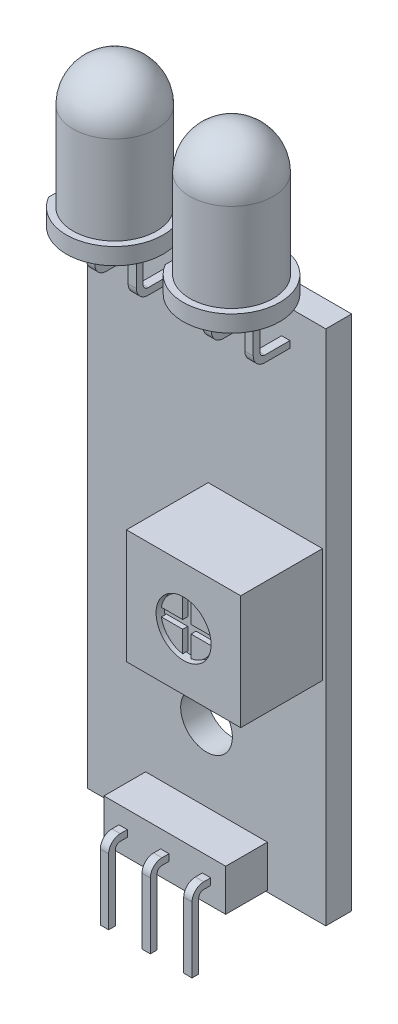
from build123d import *

# Parameters (mm, degrees)
ESBO_O1_W                   = 14.3
ESBO_O1_H                   = 31
ESBO_O1_R                   = 1.55
RESSALTO_EXTRUS_O1_DEPTH    = 1.55
ESBO_O2_W                   = 6.85
ESBO_O2_H                   = 6.85
RESSALTO_EXTRUS_O2_DEPTH    = 6.45
ESBO_O3_R                   = 1.65
CORTE_EXTRUS_O1_DEPTH       = 0.5
ESBO_O4_W                   = 7.3
ESBO_O4_H                   = 2.5
RESSALTO_EXTRUS_O3_DEPTH    = 4.05
RESSALTO_EXTRUS_O4_DEPTH    = 1
RESSALTO_EXTRUS_O4_2_DEPTH  = 1
ESBO_O6_R                   = 2.5
RESSALTO_EXTRUS_O5_DEPTH    = 8.8
FILETE1_R                   = 2.5
FILETE2_R                   = 2.5
RESSALTO_EXTRUS_O6_DEPTH    = 13.8
ESBO_O9_R                   = 1.55
CORTE_EXTRUS_O3_DEPTH       = 0.2
CORTE_EXTRUS_O2_START       = -2.2
CORTE_EXTRUS_O2_OUTLINE_W   = 1.65
CORTE_EXTRUS_O2_OUTLINE_H   = 3.08301819
CORTE_EXTRUS_O2_OUTLINE_W_2 = 2
CORTE_EXTRUS_O2_OUTLINE_W_3 = 4
CORTE_EXTRUS_O2_OUTLINE_W_4 = 2.15
CORTE_EXTRUS_O2_DEPTH       = 2.2
RESSALTO_EXTRUS_O7_START    = -7.3
RESSALTO_EXTRUS_O7_DEPTH    = 7.3
ESBO_O12_W                  = 1.34798559
ESBO_O12_H                  = 5.991047065
ESBO_O12_W_2                = 0.998507844
ESBO_O12_W_3                = 2
CORTE_EXTRUS_O4_DEPTH       = 2.2


# Read off the part's stored shape, not the designer's step: Corte-extrusão2, Ressalto-extrusão7
with BuildPart() as part:
    # Esboço1 → Ressalto-extrusão1 (new body)
    with BuildSketch(Plane.XY):
        Rectangle(ESBO_O1_W, ESBO_O1_H)
        with Locations(Location((0, -8.5, 0), (0, 0, 180))):
            Circle(ESBO_O1_R, mode=Mode.SUBTRACT)
    extrude(amount=RESSALTO_EXTRUS_O1_DEPTH)

    # Esboço2 → Ressalto-extrusão2 (add)
    with BuildSketch(Plane.XY):
        with Locations((3.525, 0.5664641)):
            Rectangle(ESBO_O2_W, ESBO_O2_H)
    extrude(amount=RESSALTO_EXTRUS_O2_DEPTH)

    # Esboço3 → Corte-extrusão1 (cut)
    with BuildSketch(Plane.XY.offset(6.45)):
        with Locations((3.525, 0.5664641)):
            Circle(ESBO_O3_R)
        with BuildLine():
            Line((3.775, 0.8164641), (3.775, 2.096169954))
            ThreePointArc((3.775, 2.096169954), (4.621015511, 1.662479611), (5.054705854, 0.8164641))
            Line((5.054705854, 0.8164641), (3.775, 0.8164641))
        make_face(mode=Mode.SUBTRACT)
        with BuildLine():
            Line((3.775, -0.963241754), (3.775, 0.3164641))
            Line((3.775, 0.3164641), (5.054705854, 0.3164641))
            ThreePointArc((5.054705854, 0.3164641), (4.621015511, -0.529551411), (3.775, -0.963241754))
        make_face(mode=Mode.SUBTRACT)
        with BuildLine():
            Line((3.275, -0.963241754), (3.275, 0.3164641))
            Line((3.275, 0.3164641), (1.995294146, 0.3164641))
            ThreePointArc((1.995294146, 0.3164641), (2.428984489, -0.529551411), (3.275, -0.963241754))
        make_face(mode=Mode.SUBTRACT)
        with BuildLine():
            Line((3.275, 0.8164641), (3.275, 2.096169954))
            ThreePointArc((3.275, 2.096169954), (2.428984489, 1.662479611), (1.995294146, 0.8164641))
            Line((1.995294146, 0.8164641), (3.275, 0.8164641))
        make_face(mode=Mode.SUBTRACT)
    extrude(amount=-CORTE_EXTRUS_O1_DEPTH, mode=Mode.SUBTRACT)

    # Esboço4 → Ressalto-extrusão3 (add)
    with BuildSketch(Plane.XY):
        with Locations((0, -14.15)):
            Rectangle(ESBO_O4_W, ESBO_O4_H)
    extrude(amount=RESSALTO_EXTRUS_O3_DEPTH)



with BuildPart() as body_2:
    # Esboço5 → Ressalto-extrusão4 (new body)
    with BuildSketch(Plane(origin=(0, 16.5, 0), x_dir=(1, 0, 0), z_dir=(0, 1, 0))):
        with BuildLine():
            Line((1, -5.019693846), (1, -2.080306154))
            ThreePointArc((1, -2.080306154), (6.4, -3.55), (1, -5.019693846))
        make_face()
    extrude(amount=RESSALTO_EXTRUS_O4_DEPTH)



with BuildPart() as body_3:
    # Esboço5 → Ressalto-extrus_o4 2 (new body)
    with BuildSketch(Plane(origin=(0, 16.5, 0), x_dir=(1, 0, 0), z_dir=(0, 1, 0))):
        with BuildLine():
            Line((-6, -2.080306154), (-6, -5.019693846))
            ThreePointArc((-6, -5.019693846), (-0.6, -3.55), (-6, -2.080306154))
        make_face()
    extrude(amount=RESSALTO_EXTRUS_O4_2_DEPTH)


with BuildPart() as body_2_1:
    add(body_2.part)

    add(body_3.part)  # Ressalto-extrusão5 merges body 3
    # Esboço6 → Ressalto-extrusão5 (add)
    with BuildSketch(Plane(origin=(0, 16.5, 0), x_dir=(1, 0, 0), z_dir=(0, 1, 0))):
        with Locations(Location((3.5, -3.55, 0), (0, 0, 180))):
            Circle(ESBO_O6_R)
        with Locations(Location((-3.5, -3.55, 0), (0, 0, 180))):
            Circle(ESBO_O6_R)
    extrude(amount=RESSALTO_EXTRUS_O5_DEPTH)

    # Filete1
    filete1_edges = [body_2_1.edges().sort_by_distance(p)[0] for p in [
        (-1, 25.3, 3.55),
    ]]
    fillet(filete1_edges, radius=FILETE1_R)

    # Filete2
    filete2_edges = [body_2_1.edges().sort_by_distance(p)[0] for p in [
        (6, 25.3, 3.55),
    ]]
    fillet(filete2_edges, radius=FILETE2_R)


with BuildPart() as part_1:
    add(part.part)

    add(body_2_1.part)  # Ressalto-extrusão6 merges body 2
    # Esboço7 → Ressalto-extrusão6 (add)
    with BuildSketch(Plane.ZY.offset(7.15)):
        with BuildLine():
            Line((3.35, 16.5), (3.35, 14.11698181))
            ThreePointArc((3.35, 14.11698181), (3.262132034, 13.904849775), (3.05, 13.81698181))
            Line((3.05, 13.81698181), (1.55, 13.81698181))
            Line((1.55, 13.81698181), (1.55, 13.41698181))
            Line((1.55, 13.41698181), (3.05, 13.41698181))
            ThreePointArc((3.05, 13.41698181), (3.544974747, 13.622007063), (3.75, 14.11698181))
            Line((3.75, 14.11698181), (3.75, 16.5))
            Line((3.75, 16.5), (3.35, 16.5))
        make_face()
    extrude(amount=-RESSALTO_EXTRUS_O6_DEPTH)

    # Esboço9 → Corte-extrusão3 (cut)
    with BuildSketch(Plane.XY.offset(6.45)):
        with Locations((3.525, 0.5664641)):
            Circle(ESBO_O9_R)
    extrude(amount=-CORTE_EXTRUS_O3_DEPTH, mode=Mode.SUBTRACT)

    # Corte-extrusão2 outline → Corte-extrusão2 (cut)
    with BuildSketch(Plane.XY.offset(3.75).offset(CORTE_EXTRUS_O2_START)):
        with Locations((5.825, 14.958490905)):
            Rectangle(CORTE_EXTRUS_O2_OUTLINE_W, CORTE_EXTRUS_O2_OUTLINE_H)
        with Locations((3.5, 14.958490905)):
            Rectangle(CORTE_EXTRUS_O2_OUTLINE_W_2, CORTE_EXTRUS_O2_OUTLINE_H)
        with Locations((0, 14.958490905)):
            Rectangle(CORTE_EXTRUS_O2_OUTLINE_W_3, CORTE_EXTRUS_O2_OUTLINE_H)
        with Locations((-3.5, 14.958490905)):
            Rectangle(CORTE_EXTRUS_O2_OUTLINE_W_2, CORTE_EXTRUS_O2_OUTLINE_H)
        with Locations((-6.075, 14.958490905)):
            Rectangle(CORTE_EXTRUS_O2_OUTLINE_W_4, CORTE_EXTRUS_O2_OUTLINE_H)
    extrude(amount=CORTE_EXTRUS_O2_DEPTH, mode=Mode.SUBTRACT)

    # Ressalto-extrusão7 outline → Ressalto-extrusão7 (add)
    with BuildSketch(Plane.ZY.offset(3.65).offset(RESSALTO_EXTRUS_O7_START)):
        with BuildLine():
            ThreePointArc((5.167357012, -14.65), (4.962331759, -14.155025253), (4.467357012, -13.95))
            Line((4.467357012, -13.95), (4.05, -13.95))
            Line((4.05, -13.95), (4.05, -14.35))
            Line((4.05, -14.35), (4.467357012, -14.35))
            ThreePointArc((4.467357012, -14.35), (4.679489046, -14.437867966), (4.767357012, -14.65))
            Line((4.767357012, -14.65), (4.767357012, -18.595051461))
            Line((4.767357012, -18.595051461), (5.167357012, -18.595051461))
            Line((5.167357012, -18.595051461), (5.167357012, -14.65))
        make_face()
    extrude(amount=RESSALTO_EXTRUS_O7_DEPTH)

    # Esboço12 → Corte-extrusão4 (cut)
    with BuildSketch(Plane.XY.offset(4.05)):
        with Locations((-3.423992795, -16.372351479)):
            Rectangle(ESBO_O12_W, ESBO_O12_H)
        with Locations((3.249253922, -16.372351479)):
            Rectangle(ESBO_O12_W_2, ESBO_O12_H)
        with Locations((-1.25, -16.372351479)):
            Rectangle(ESBO_O12_W_3, ESBO_O12_H)
        with Locations((1.25, -16.372351479)):
            Rectangle(ESBO_O12_W_3, ESBO_O12_H)
    extrude(amount=CORTE_EXTRUS_O4_DEPTH, mode=Mode.SUBTRACT)


solid = part_1.part
